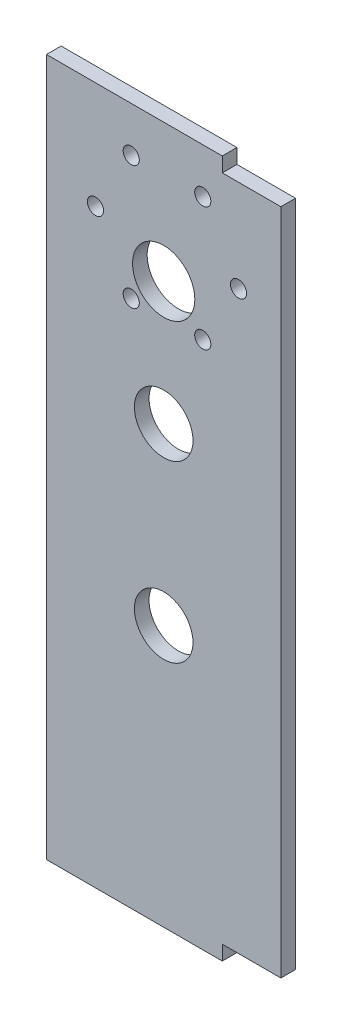
from build123d import *

# Parameters (mm, degrees)
SKETCH_1_R      = 6.75
SKETCH_1_R_2    = 1.75
SKETCH_1_R_3    = 6.35
EXTRUDE_1_DEPTH = 3.175


with BuildPart() as part:
    # Эскиз1 → Бобышка-Вытянуть1 (new body)
    with BuildSketch(Plane.XY):
        Polygon((19.05, 151.13), (-19.05, 151.13), (-19.05, 0), (19.05, 0), (19.05, 3.175), (31.75, 3.175), (31.75, 147.955), (19.05, 147.955), align=None)
        with Locations((6.35, 121.243303121)):
            Circle(SKETCH_1_R, mode=Mode.SUBTRACT)
        with Locations((22.568070331, 127.955)):
            Circle(SKETCH_1_R_2, mode=Mode.SUBTRACT)
        with Locations((14.818070331, 114.531606241)):
            Circle(SKETCH_1_R_2, mode=Mode.SUBTRACT)
        with Locations((-0.681929669, 114.531606241)):
            Circle(SKETCH_1_R_2, mode=Mode.SUBTRACT)
        with Locations((-8.431929669, 127.955)):
            Circle(SKETCH_1_R_2, mode=Mode.SUBTRACT)
        with Locations((-0.681929669, 141.378393759)):
            Circle(SKETCH_1_R_2, mode=Mode.SUBTRACT)
        with Locations((14.818070331, 141.378393759)):
            Circle(SKETCH_1_R_2, mode=Mode.SUBTRACT)
        with Locations((6.35, 94.49915156)):
            Circle(SKETCH_1_R_3, mode=Mode.SUBTRACT)
        with Locations((6.35, 56.63084844)):
            Circle(SKETCH_1_R_3, mode=Mode.SUBTRACT)
    extrude(amount=EXTRUDE_1_DEPTH)


solid = part.part
